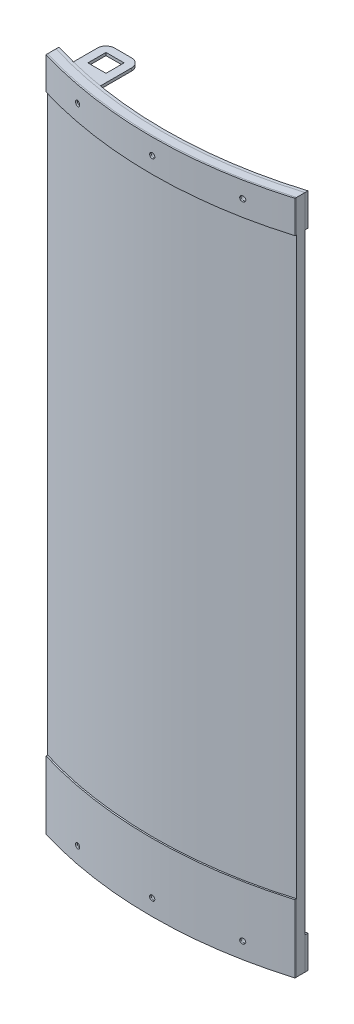
from build123d import *

# Parameters (mm, degrees)
BOSS_EXTRUDE1_DEPTH      = 398.272
BOSS_EXTRUDE2_DEPTH      = 19.05
BOSS_EXTRUDE3_DEPTH      = 19.05
BOSS_EXTRUDE4_DEPTH      = 39.878
BOSS_EXTRUDE5_DEPTH      = 19.05
CUT_EXTRUDE1_DEPTH       = 508
SKETCH7_W                = 10.643644845
SKETCH7_H                = 10.643644845
BOSS_EXTRUDE6_DEPTH      = 1.651
FILLET1_R                = 5.08
MOVE_START               = 397.002
MOVE_FACE1_DEPTH         = 1.27
MOVE_FACE2_BY            = 1.27
MOVE_FACE3_BY            = 1.27
MOVE_FACE4_BY            = 1.27
MOVE_FACE5_BY            = 1.27
SKETCH8_R                = 1.524
CUT_EXTRUDE3_DEPTH       = 25.4
CIRPATTERN1_COUNT        = 2
CIRPATTERN1_ANGLE        = 11
MIRROR1_COPY_1_SKETCH_R  = 1.524
MIRROR1_COPY_1_DEPTH     = 25.4
MOVE_START_2             = 11.147890997
MOVE_FACE6_OUTLINE_R     = 2.159
MOVE_FACE6_OUTLINE_R_2   = 1.524
MOVE_FACE6_DEPTH         = 4.771870459
MOVE_START_3             = -20.284632618
MOVE_FACE6_2_OUTLINE_R   = 2.159
MOVE_FACE6_2_OUTLINE_R_2 = 1.524
MOVE_FACE6_2_DEPTH       = 4.771870462
MOVE_START_4             = 15.512762156
MOVE_FACE6_3_OUTLINE_R   = 2.159
MOVE_FACE6_3_OUTLINE_R_2 = 1.524
MOVE_FACE6_3_DEPTH       = 4.771870458


# Read off the part's stored shape, not the designer's step: Move Face1, Move Face6
with BuildPart() as part:
    # Sketch1 → Boss-Extrude1 (new body)
    with BuildSketch(Plane(origin=(0, 0, 0), x_dir=(1, 0, 0), z_dir=(0, 1, 0))):
        with BuildLine():
            Line((-73.66, 0), (-75.070390605, -4.548868496))
            ThreePointArc((-75.070390605, -4.548868496), (0, -15.919761365), (75.070390605, -4.548868496))
            Line((75.070390605, -4.548868496), (73.66, 0))
            ThreePointArc((73.66, 0), (0, -11.157261365), (-73.66, 0))
        make_face()
    extrude(amount=BOSS_EXTRUDE1_DEPTH)


with BuildPart() as body_2:
    # Sketch2 → Boss-Extrude2 (new body)
    with BuildSketch(Plane(origin=(0, 398.272, 0), x_dir=(1, 0, 0), z_dir=(0, 1, 0))):
        with BuildLine():
            Line((-75.070390605, -4.548868496), (-75.333663518, -5.397990615))
            ThreePointArc((-75.333663518, -5.397990615), (0, -16.808761365), (75.333663518, -5.397990615))
            Line((75.333663518, -5.397990615), (75.070390605, -4.548868496))
            ThreePointArc((75.070390605, -4.548868496), (0, -15.919761365), (-75.070390605, -4.548868496))
        make_face()
    extrude(amount=-BOSS_EXTRUDE2_DEPTH)


with BuildPart() as body_3:
    # Sketch3 → Boss-Extrude3 (new body)
    with BuildSketch(Plane(origin=(0, 398.272, 0), x_dir=(1, 0, 0), z_dir=(0, 1, 0))):
        with BuildLine():
            Line((-73.17106459, 1.576941079), (-73.66, 0))
            ThreePointArc((-73.66, 0), (0, -11.157261365), (73.66, 0))
            Line((73.66, 0), (73.17106459, 1.576941079))
            ThreePointArc((73.17106459, 1.576941079), (0, -9.506261365), (-73.17106459, 1.576941079))
        make_face()
    extrude(amount=-BOSS_EXTRUDE3_DEPTH)


with BuildPart() as body_4:
    # Sketch4 → Boss-Extrude4 (new body)
    with BuildSketch(Plane.XZ):
        with BuildLine():
            Line((75.070390605, 4.548868496), (75.333663518, 5.397990615))
            ThreePointArc((75.333663518, 5.397990615), (0, 16.808761365), (-75.333663518, 5.397990615))
            Line((-75.333663518, 5.397990615), (-75.070390605, 4.548868496))
            ThreePointArc((-75.070390605, 4.548868496), (0, 15.919761365), (75.070390605, 4.548868496))
        make_face()
    extrude(amount=-BOSS_EXTRUDE4_DEPTH)


with BuildPart() as body_5:
    # Sketch5 → Boss-Extrude5 (new body)
    with BuildSketch(Plane.XZ):
        with BuildLine():
            Line((-73.66, 0), (-73.17106459, -1.576941079))
            ThreePointArc((-73.17106459, -1.576941079), (0, 9.506261365), (73.17106459, -1.576941079))
            Line((73.17106459, -1.576941079), (73.66, 0))
            ThreePointArc((73.66, 0), (0, 11.157261365), (-73.66, 0))
        make_face()
    extrude(amount=-BOSS_EXTRUDE5_DEPTH)


with BuildPart() as cut_extrude1_tool:
    # Sketch6 → Cut-Extrude1 (new body)
    with BuildSketch(Plane(origin=(0, 0, 0), x_dir=(1, 0, 0), z_dir=(0, 1, 0))):
        Polygon((73.17106459, 1.576941079), (73.17106459, -8.359096802), (86.604464861, -0.591303231), align=None)
        Polygon((-73.17106459, 1.576941079), (-73.17106459, -8.359096802), (-85.415039494, 1.576941079), align=None)
    extrude(amount=CUT_EXTRUDE1_DEPTH)


with BuildPart() as part_1:
    add(part.part)

    # Cut-Extrude1: cut by cut_extrude1_tool
    add(cut_extrude1_tool.part, mode=Mode.SUBTRACT)

    # Move Face2: a face moved inward by 1.27
    extrude(part_1.faces().sort_by_distance((0, 398.272, 11.977582218))[0], amount=MOVE_FACE2_BY, dir=(0, -1, 0), mode=Mode.SUBTRACT)


with BuildPart() as body_2_1:
    add(body_2.part)

    # Cut-Extrude1: cut by cut_extrude1_tool
    add(cut_extrude1_tool.part, mode=Mode.SUBTRACT)

    # Move Face1 outline → Move Face1 (cut)
    with BuildSketch(Plane(origin=(0, 0, 0), x_dir=(1, 0, 0), z_dir=(0, 1, 0)).offset(MOVE_START)):
        with BuildLine():
            ThreePointArc((73.17106459, -5.129614202), (0, -15.919761365), (-73.17106459, -5.129614202))
            Line((-73.17106459, -5.129614202), (-73.17106459, -6.057990334))
            ThreePointArc((-73.17106459, -6.057990334), (0, -16.808761365), (73.17106459, -6.057990334))
            Line((73.17106459, -6.057990334), (73.17106459, -5.129614202))
        make_face()
    extrude(amount=MOVE_FACE1_DEPTH, mode=Mode.SUBTRACT)

    # Move Face5: a face moved outward by 1.27
    extrude(body_2_1.faces().sort_by_distance((-36.585532295, 379.222, 13.888974574))[0], amount=MOVE_FACE5_BY, dir=(0, -1, 0))


with BuildPart() as body_3_1:
    add(body_3.part)

    # Cut-Extrude1: cut by cut_extrude1_tool
    add(cut_extrude1_tool.part, mode=Mode.SUBTRACT)

    # Sketch7 → Boss-Extrude6 (add)
    with BuildSketch(Plane(origin=(0, 396.748, 0), x_dir=(1, 0, 0), z_dir=(0, 1, 0))):
        with BuildLine():
            Line((-61.679949741, -1.683626417), (-61.679949741, 17.687917762))
            Line((-61.679949741, 17.687917762), (-41.511304896, 17.687917762))
            Line((-41.511304896, 17.687917762), (-41.511304896, -5.994172694))
            ThreePointArc((-41.511304896, -5.994172694), (-51.640623164, -4.049430926), (-61.679949741, -1.683626417))
        make_face()
        with Locations((-51.595627319, 7.603595339)):
            Rectangle(SKETCH7_W, SKETCH7_H, mode=Mode.SUBTRACT)
    extrude(amount=-BOSS_EXTRUDE6_DEPTH)

    # Fillet1
    fillet1_edges = [body_3_1.edges().sort_by_distance(p)[0] for p in [
        (-61.679949741, 395.9225, -17.687917762),
        (-41.511304896, 395.9225, -17.687917762),
    ]]
    fillet(fillet1_edges, radius=FILLET1_R)

    # Move Face3: a face moved inward by 1.27
    extrude(body_3_1.faces().sort_by_distance((0, 398.272, 9.88384112))[0], amount=MOVE_FACE3_BY, dir=(0, -1, 0), mode=Mode.SUBTRACT)

    # Move Face4: a face moved outward by 1.27
    extrude(body_3_1.faces().sort_by_distance((0, 379.222, 9.88384112))[0], amount=MOVE_FACE4_BY, dir=(0, -1, 0))


with BuildPart() as body_4_1:
    add(body_4.part)

    # Cut-Extrude1: cut by cut_extrude1_tool
    add(cut_extrude1_tool.part, mode=Mode.SUBTRACT)


with BuildPart() as body_5_1:
    add(body_5.part)

    # Cut-Extrude1: cut by cut_extrude1_tool
    add(cut_extrude1_tool.part, mode=Mode.SUBTRACT)


with BuildPart() as cut_extrude3_tool:
    # Sketch8 → Cut-Extrude3 (new, symmetric)
    with BuildSketch(Plane.XY):
        with Locations((0, 9.525)):
            Circle(SKETCH8_R)
        with Locations((0, 387.477)):
            Circle(SKETCH8_R)
    cut_extrude3 = extrude(amount=CUT_EXTRUDE3_DEPTH, both=True)


with BuildPart() as part_2:
    add(part_1.part)

    # Cut-Extrude3: cut by cut_extrude3_tool
    add(cut_extrude3_tool.part, mode=Mode.SUBTRACT)


with BuildPart() as body_2_2:
    add(body_2_1.part)

    # Cut-Extrude3: cut by cut_extrude3_tool
    add(cut_extrude3_tool.part, mode=Mode.SUBTRACT)


with BuildPart() as body_3_2:
    add(body_3_1.part)

    # Cut-Extrude3: cut by cut_extrude3_tool
    add(cut_extrude3_tool.part, mode=Mode.SUBTRACT)


with BuildPart() as body_4_2:
    add(body_4_1.part)

    # Cut-Extrude3: cut by cut_extrude3_tool
    add(cut_extrude3_tool.part, mode=Mode.SUBTRACT)


with BuildPart() as body_5_2:
    add(body_5_1.part)

    # Cut-Extrude3: cut by cut_extrude3_tool
    add(cut_extrude3_tool.part, mode=Mode.SUBTRACT)


with BuildPart() as cirpattern1_tool:
    # CirPattern1: Cut-Extrude3 ×2 about axis
    cirpattern1_axis = Axis((0, 398.272, -237.572238635), (0, -1, 0))
    for i in range(1, CIRPATTERN1_COUNT):
        add(cut_extrude3.rotate(cirpattern1_axis, i * CIRPATTERN1_ANGLE / (CIRPATTERN1_COUNT - 1)))


with BuildPart() as part_3:
    add(part_2.part)

    # CirPattern1: cut by cirpattern1_tool
    add(cirpattern1_tool.part, mode=Mode.SUBTRACT)


with BuildPart() as body_2_3:
    add(body_2_2.part)

    # CirPattern1: cut by cirpattern1_tool
    add(cirpattern1_tool.part, mode=Mode.SUBTRACT)


with BuildPart() as body_3_3:
    add(body_3_2.part)

    # CirPattern1: cut by cirpattern1_tool
    add(cirpattern1_tool.part, mode=Mode.SUBTRACT)


with BuildPart() as body_4_3:
    add(body_4_2.part)

    # CirPattern1: cut by cirpattern1_tool
    add(cirpattern1_tool.part, mode=Mode.SUBTRACT)


with BuildPart() as body_5_3:
    add(body_5_2.part)

    # CirPattern1: cut by cirpattern1_tool
    add(cirpattern1_tool.part, mode=Mode.SUBTRACT)


with BuildPart() as mirror1_copy_1_tool:
    # Mirror1 copy 1 sketch → Mirror1 copy 1 (new, symmetric)
    with BuildSketch(Plane(origin=(45.330920183, 0, -4.364871158), x_dir=(-0.9816271834476639, 0, 0.19080899537654525), z_dir=(0.19080899537654525, 0, 0.9816271834476639))):
        with Locations((0, -9.525)):
            Circle(MIRROR1_COPY_1_SKETCH_R)
        with Locations((0, -387.477)):
            Circle(MIRROR1_COPY_1_SKETCH_R)
    extrude(amount=MIRROR1_COPY_1_DEPTH, both=True)


with BuildPart() as part_4:
    add(part_3.part)

    # Mirror1 copy 1: cut by mirror1_copy_1_tool
    add(mirror1_copy_1_tool.part, mode=Mode.SUBTRACT)

    # Move Face6 outline → Move Face6 (cut)
    # profile 1 of 2: a face of its own
    with BuildSketch(Plane.XY.offset(MOVE_START_2)):
        with Locations((0, 387.477)):
            Circle(MOVE_FACE6_OUTLINE_R)
        with Locations((0, 387.477)):
            Circle(MOVE_FACE6_OUTLINE_R_2, mode=Mode.SUBTRACT)
    # profile 2 of 2: a face of its own
    with BuildSketch(Plane.XY.offset(MOVE_START_2)):
        with Locations((0, 9.525)):
            Circle(MOVE_FACE6_OUTLINE_R)
        with Locations((0, 9.525)):
            Circle(MOVE_FACE6_OUTLINE_R_2, mode=Mode.SUBTRACT)
    extrude(amount=MOVE_FACE6_DEPTH, mode=Mode.SUBTRACT)

    # Move Face6 2 outline → Move Face6 2 (cut)
    # profile 1 of 2: a face of its own
    with BuildSketch(Plane(origin=(0, 0, 0), x_dir=(0.981627183447664, 0, 0.19080899537654503), z_dir=(0.190808995376545, 0, -0.981627183447664)).offset(MOVE_START_3)):
        with Locations((-45.330920183, -9.525)):
            Circle(MOVE_FACE6_2_OUTLINE_R)
        with Locations((-45.330920183, -9.525)):
            Circle(MOVE_FACE6_2_OUTLINE_R_2, mode=Mode.SUBTRACT)
    # profile 2 of 2: a face of its own
    with BuildSketch(Plane(origin=(0, 0, 0), x_dir=(0.981627183447664, 0, 0.19080899537654503), z_dir=(0.190808995376545, 0, -0.981627183447664)).offset(MOVE_START_3)):
        with Locations((-45.330920183, -387.477)):
            Circle(MOVE_FACE6_2_OUTLINE_R)
        with Locations((-45.330920183, -387.477)):
            Circle(MOVE_FACE6_2_OUTLINE_R_2, mode=Mode.SUBTRACT)
    extrude(amount=MOVE_FACE6_2_DEPTH, mode=Mode.SUBTRACT)

    # Move Face6 3 outline → Move Face6 3 (cut)
    # profile 1 of 2: a face of its own
    with BuildSketch(Plane(origin=(0, 0, 0), x_dir=(0.981627183447664, 0, -0.19080899537654503), z_dir=(0.190808995376545, 0, 0.981627183447664)).offset(MOVE_START_4)):
        with Locations((45.330920183, 387.477)):
            Circle(MOVE_FACE6_3_OUTLINE_R)
        with Locations((45.330920183, 387.477)):
            Circle(MOVE_FACE6_3_OUTLINE_R_2, mode=Mode.SUBTRACT)
    # profile 2 of 2: a face of its own
    with BuildSketch(Plane(origin=(0, 0, 0), x_dir=(0.981627183447664, 0, -0.19080899537654503), z_dir=(0.190808995376545, 0, 0.981627183447664)).offset(MOVE_START_4)):
        with Locations((45.330920183, 9.525)):
            Circle(MOVE_FACE6_3_OUTLINE_R)
        with Locations((45.330920183, 9.525)):
            Circle(MOVE_FACE6_3_OUTLINE_R_2, mode=Mode.SUBTRACT)
    extrude(amount=MOVE_FACE6_3_DEPTH, mode=Mode.SUBTRACT)


with BuildPart() as body_2_4:
    add(body_2_3.part)

    # Mirror1 copy 1: cut by mirror1_copy_1_tool
    add(mirror1_copy_1_tool.part, mode=Mode.SUBTRACT)


with BuildPart() as body_3_4:
    add(body_3_3.part)

    # Mirror1 copy 1: cut by mirror1_copy_1_tool
    add(mirror1_copy_1_tool.part, mode=Mode.SUBTRACT)


with BuildPart() as body_4_4:
    add(body_4_3.part)

    # Mirror1 copy 1: cut by mirror1_copy_1_tool
    add(mirror1_copy_1_tool.part, mode=Mode.SUBTRACT)


with BuildPart() as body_5_4:
    add(body_5_3.part)

    # Mirror1 copy 1: cut by mirror1_copy_1_tool
    add(mirror1_copy_1_tool.part, mode=Mode.SUBTRACT)


solid = Compound([part_4.part, body_2_4.part, body_3_4.part, body_4_4.part, body_5_4.part])
